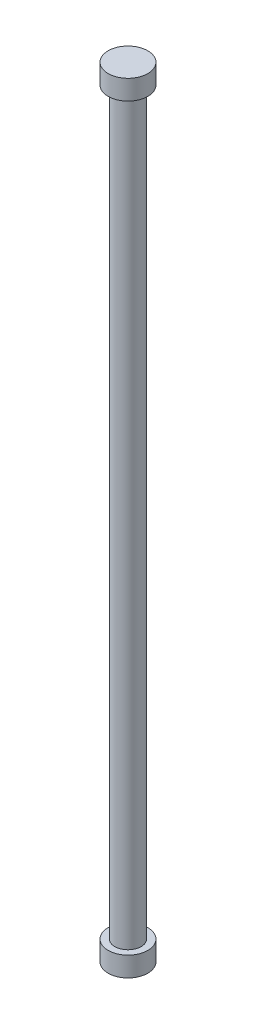
from build123d import *

# Parameters (mm, degrees)
SKETCH1_R           = 15
BOSS_EXTRUDE1_DEPTH = 15
SKETCH2_R           = 10
BOSS_EXTRUDE2_DEPTH = 560.5
SKETCH3_R           = 15
BOSS_EXTRUDE3_DEPTH = 15


with BuildPart() as part:
    # Sketch1 → Boss-Extrude1 (new body)
    with BuildSketch(Plane(origin=(0, 0, 0), x_dir=(-1, 0, 0), z_dir=(0, 1, 0))):
        Circle(SKETCH1_R)
    extrude(amount=BOSS_EXTRUDE1_DEPTH)

    # Sketch2 → Boss-Extrude2 (add)
    with BuildSketch(Plane(origin=(0, 15, 0), x_dir=(-1, 0, 0), z_dir=(0, 1, 0))):
        Circle(SKETCH2_R)
    extrude(amount=BOSS_EXTRUDE2_DEPTH)

    # Sketch3 → Boss-Extrude3 (add)
    with BuildSketch(Plane(origin=(0, 575.5, 0), x_dir=(-1, 0, 0), z_dir=(0, 1, 0))):
        Circle(SKETCH3_R)
    extrude(amount=BOSS_EXTRUDE3_DEPTH)


solid = part.part
